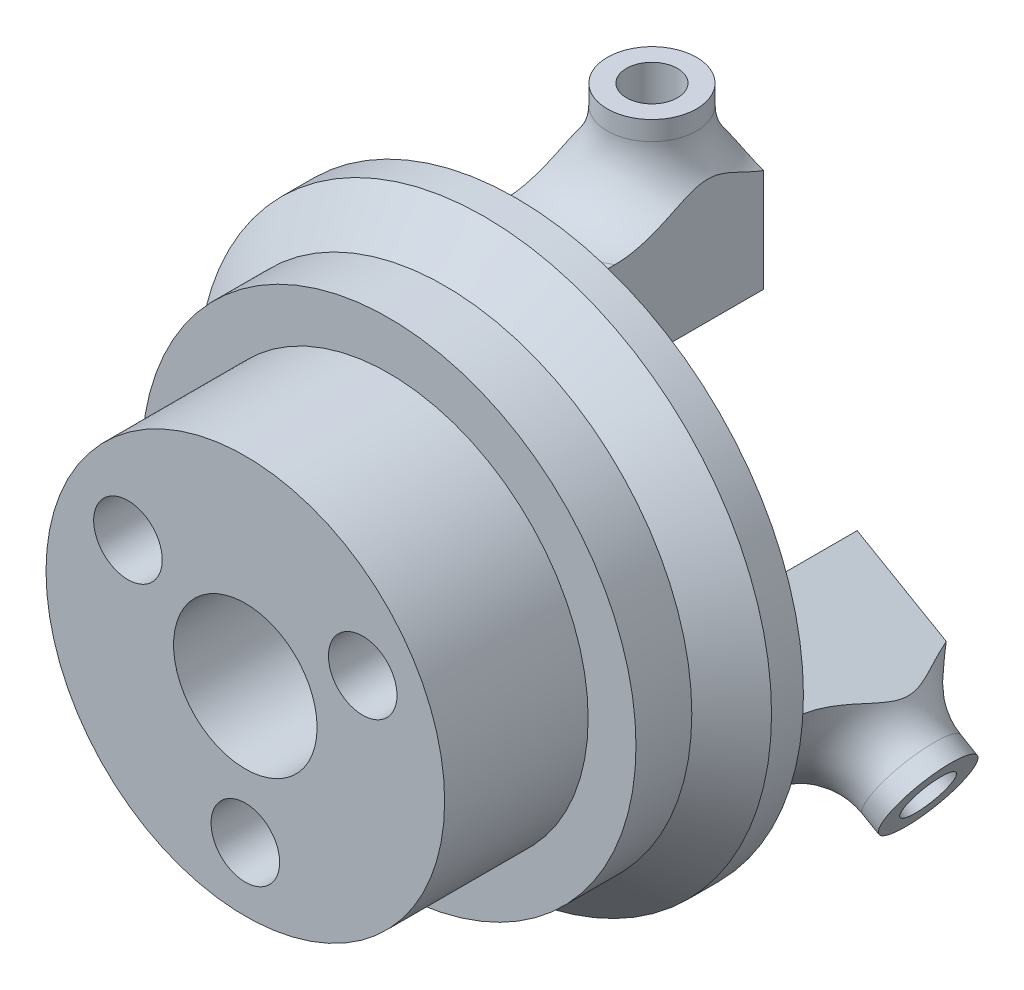
from build123d import *

# Parameters (mm, degrees)
SKETCH1_R                = 18
SKETCH1_R_2              = 4
BOSS_EXTRUDE1_DEPTH      = 2.5
SKETCH5_R                = 7.5
SKETCH5_R_2              = 4
BOSS_EXTRUDE3_DEPTH      = 1
SKETCH8_R                = 12.5
SKETCH8_R_2              = 4.5
BOSS_EXTRUDE5_DEPTH      = 12
SKETCH9_R                = 15.5
SKETCH9_R_2              = 12.5
BOSS_EXTRUDE6_DEPTH      = 3
M4_CLEARANCE_HOLE1_D     = 4.3
CUT_EXTRUDE2_DEPTH       = 2
CIRPATTERN2_COUNT        = 3
SKETCH15_W               = 7
SKETCH15_H               = 6
BOSS_EXTRUDE7_DEPTH      = 12
SKETCH16_R               = 2.8
BOSS_EXTRUDE8_DEPTH      = 5.2
SKETCH17_R               = 1.6
CUT_EXTRUDE3_DEPTH       = 9
CHAMFER1_SIZE            = 3
CUT_EXTRUDE5_DEPTH       = 2.85
FILLET3_R                = 4
FILLET5_R                = 1
CIRPATTERN4_COUNT        = 3
FILLET3_OF_CIRPATTERN4_R = 4
FILLET5_OF_CIRPATTERN4_R = 1


with BuildPart() as part:
    # Sketch1 → Boss-Extrude1 (new, symmetric)
    with BuildSketch(Plane.XY):
        Circle(SKETCH1_R)
        Circle(SKETCH1_R_2, mode=Mode.SUBTRACT)
    extrude(amount=BOSS_EXTRUDE1_DEPTH, both=True)

    # Sketch5 → Boss-Extrude3 (add)
    with BuildSketch(Plane.XY.offset(-2.5)):
        Circle(SKETCH5_R)
        Circle(SKETCH5_R_2, mode=Mode.SUBTRACT)
    extrude(amount=BOSS_EXTRUDE3_DEPTH)

    # Sketch8 → Boss-Extrude5 (add)
    with BuildSketch(Plane.XY.offset(2.5)):
        Circle(SKETCH8_R)
        Circle(SKETCH8_R_2, mode=Mode.SUBTRACT)
    extrude(amount=BOSS_EXTRUDE5_DEPTH)

    # Sketch9 → Boss-Extrude6 (add)
    with BuildSketch(Plane.XY.offset(2.5)):
        Circle(SKETCH9_R)
        Circle(SKETCH9_R_2, mode=Mode.SUBTRACT)
    extrude(amount=BOSS_EXTRUDE6_DEPTH)

    # M4 Clearance Hole1 (through all)
    with Locations(Plane.XY.offset(14.5)):
        with Locations((7.361215932, 4.25), (-7.361215932, 4.25), (0, -8.5)):
            Hole(M4_CLEARANCE_HOLE1_D / 2)

    # Sketch14 → Cut-Extrude2 (cut)
    with BuildSketch(Plane(origin=(0, 0, -2.5), x_dir=(-1, 0, 0), z_dir=(0, 0, -1))):
        Polygon((-11.691342951, 4.25), (-9.526279442, 8), (-5.196152423, 8), (-3.031088913, 4.25), (-5.196152423, 0.5), (-9.526279442, 0.5), align=None)
    cut_extrude2 = extrude(amount=-CUT_EXTRUDE2_DEPTH, mode=Mode.SUBTRACT)

    # CirPattern2: Cut-Extrude2 ×3 about axis
    cirpattern2_axis = Axis((0, 0, 0), (0, 0, 1))
    for i in range(1, CIRPATTERN2_COUNT):
        add(cut_extrude2.rotate(cirpattern2_axis, i * 360 / CIRPATTERN2_COUNT), mode=Mode.SUBTRACT)

    # Sketch15 → Boss-Extrude7 (add)
    with BuildSketch(Plane(origin=(0, 0, -2.5), x_dir=(-1, 0, 0), z_dir=(0, 0, -1))):
        with Locations((0, 11.8)):
            Rectangle(SKETCH15_W, SKETCH15_H)
    boss_extrude7 = extrude(amount=BOSS_EXTRUDE7_DEPTH)

    # Sketch16 → Boss-Extrude8 (add)
    with BuildSketch(Plane(origin=(0, 14.8, 0), x_dir=(1, 0, 0), z_dir=(0, 1, 0))):
        with Locations(Location((0, 11, 0), (0, 0, 90))):
            Circle(SKETCH16_R)
    boss_extrude8 = extrude(amount=BOSS_EXTRUDE8_DEPTH)

    # Sketch17 → Cut-Extrude3 (cut)
    with BuildSketch(Plane(origin=(0, 20, 0), x_dir=(1, 0, 0), z_dir=(0, 1, 0))):
        with Locations(Location((0, 11, 0), (0, 0, 270))):
            Circle(SKETCH17_R)
    cut_extrude3 = extrude(amount=-CUT_EXTRUDE3_DEPTH, mode=Mode.SUBTRACT)

    # Chamfer1
    # the kernel refuses this chamfer: 3 mm, written as the material it takes off along each edge
    with BuildSketch(Plane(origin=(0, 0, 2.5), x_dir=(1, 0, 0), z_dir=(0, -1, 0))) as chamfer1_piece_1_section:
        Polygon((18, -CHAMFER1_SIZE), (18 - CHAMFER1_SIZE, 0), (18, 0), align=None)
    chamfer1_piece_1 = revolve(axis=Axis((0, 0, 2.5), (0, 0, 1)), mode=Mode.PRIVATE)
    chamfer1_piece_1 = chamfer1_piece_1 - Plane(origin=(0, 0, 0.764094919), x_dir=(1, 0, 0), z_dir=(0, 0, -1)) * Cylinder(15.5, 72, mode=Mode.PRIVATE)
    add(chamfer1_piece_1, mode=Mode.SUBTRACT)

    # Sketch18 → Cut-Extrude5 (cut)
    with BuildSketch(Plane.XZ.offset(-8.8)):
        Polygon((-2.85, -9.354551733), (0, -7.709103466), (2.85, -9.354551733), (2.85, -12.645448267), (0, -14.290896534), (-2.85, -12.645448267), align=None)
    cut_extrude5 = extrude(amount=-CUT_EXTRUDE5_DEPTH, mode=Mode.SUBTRACT)

    # Fillet3
    # the kernel refuses this fillet: 4 mm, written as the material it adds along each edge
    with BuildSketch(Plane(origin=(0, 14.8, -11), x_dir=(0, 0, -1), z_dir=(1, 0, 0))) as fillet3_piece_1_section:
        with BuildLine():
            CenterArc((2.8 + FILLET3_R, FILLET3_R), FILLET3_R, 180, 90)
            Line((2.8, FILLET3_R), (2.8, 0))
            Line((2.8, 0), (2.8 + FILLET3_R, 0))
        make_face()
    fillet3_piece_1 = revolve(axis=Axis((0, 14.8, -11), (0, 1, 0)), mode=Mode.PRIVATE)
    fillet3_piece_1 = split(fillet3_piece_1, bisect_by=Plane(origin=(3.5, 15.943283653, -7.056716347), z_dir=(-1, 0, 0)), keep=Keep.TOP, mode=Mode.PRIVATE)
    fillet3_piece_1 = split(fillet3_piece_1, bisect_by=Plane(origin=(-3.5, 15.943283653, -7.056716347), z_dir=(1, 0, 0)), keep=Keep.TOP, mode=Mode.PRIVATE)
    fillet3_piece_1 = split(fillet3_piece_1, bisect_by=Plane(origin=(0, 15.943283653, -14.5), z_dir=(0, 0, 1)), keep=Keep.TOP, mode=Mode.PRIVATE)
    add(fillet3_piece_1)

    # Fillet5
    fillet5_edges = [part.edges().sort_by_distance(p)[0] for p in [
        (-3.5, 11.8, -2.5),
        (3.5, 11.8, -2.5),
        (0, 8.8, -2.5),
    ]]
    fillet(fillet5_edges, radius=FILLET5_R)

    # CirPattern4: Boss-Extrude7, Boss-Extrude8, Cut-Extrude3, Cut-Extrude5 ×3 about axis
    cirpattern4_axis = Axis((0, 0, 0), (0, 0, 1))
    add([boss_extrude7.rotate(cirpattern4_axis, i * 360 / CIRPATTERN4_COUNT) for i in range(1, CIRPATTERN4_COUNT)])
    add([boss_extrude8.rotate(cirpattern4_axis, i * 360 / CIRPATTERN4_COUNT) for i in range(1, CIRPATTERN4_COUNT)])
    add([cut_extrude3.rotate(cirpattern4_axis, i * 360 / CIRPATTERN4_COUNT) for i in range(1, CIRPATTERN4_COUNT)], mode=Mode.SUBTRACT)
    add([cut_extrude5.rotate(cirpattern4_axis, i * 360 / CIRPATTERN4_COUNT) for i in range(1, CIRPATTERN4_COUNT)], mode=Mode.SUBTRACT)

    # Fillet3 of CirPattern4
    # the kernel refuses this fillet: 4 mm, written as the material it adds along each edge
    with BuildSketch(Plane(origin=(-12.817175976, -7.4, -11), x_dir=(0, 0, -1), z_dir=(-0.49999999999999983, 0.8660254037844388, 0))) as fillet3_of_cirpattern4_piece_1_section:
        with BuildLine():
            CenterArc((2.8 + FILLET3_OF_CIRPATTERN4_R, FILLET3_OF_CIRPATTERN4_R), FILLET3_OF_CIRPATTERN4_R, 180, 90)
            Line((2.8, FILLET3_OF_CIRPATTERN4_R), (2.8, 0))
            Line((2.8, 0), (2.8 + FILLET3_OF_CIRPATTERN4_R, 0))
        make_face()
    fillet3_of_cirpattern4_piece_1 = revolve(axis=Axis((-12.817175976, -7.4, -11), (-0.8660254037844388, -0.49999999999999983, 0)), mode=Mode.PRIVATE)
    fillet3_of_cirpattern4_piece_1 = split(fillet3_of_cirpattern4_piece_1, bisect_by=Plane(origin=(-15.557288663, -4.940552913, -7.056716347), z_dir=(0.49999999999999983, -0.8660254037844388, 0)), keep=Keep.TOP, mode=Mode.PRIVATE)
    fillet3_of_cirpattern4_piece_1 = split(fillet3_of_cirpattern4_piece_1, bisect_by=Plane(origin=(-12.057288663, -11.00273074, -7.056716347), z_dir=(-0.49999999999999983, 0.8660254037844388, 0)), keep=Keep.TOP, mode=Mode.PRIVATE)
    fillet3_of_cirpattern4_piece_1 = split(fillet3_of_cirpattern4_piece_1, bisect_by=Plane(origin=(-13.807288663, -7.971641826, -14.5), z_dir=(0, 0, 1)), keep=Keep.TOP, mode=Mode.PRIVATE)
    add(fillet3_of_cirpattern4_piece_1)
    with BuildSketch(Plane(origin=(12.817175976, -7.4, -11), x_dir=(0, 0, -1), z_dir=(-0.5000000000000004, -0.8660254037844384, 0))) as fillet3_of_cirpattern4_piece_2_section:
        with BuildLine():
            CenterArc((2.8 + FILLET3_OF_CIRPATTERN4_R, FILLET3_OF_CIRPATTERN4_R), FILLET3_OF_CIRPATTERN4_R, 180, 90)
            Line((2.8, FILLET3_OF_CIRPATTERN4_R), (2.8, 0))
            Line((2.8, 0), (2.8 + FILLET3_OF_CIRPATTERN4_R, 0))
        make_face()
    fillet3_of_cirpattern4_piece_2 = revolve(axis=Axis((12.817175976, -7.4, -11), (0.8660254037844384, -0.5000000000000004, 0)), mode=Mode.PRIVATE)
    fillet3_of_cirpattern4_piece_2 = split(fillet3_of_cirpattern4_piece_2, bisect_by=Plane(origin=(12.057288663, -11.00273074, -7.056716347), z_dir=(0.5000000000000004, 0.8660254037844384, 0)), keep=Keep.TOP, mode=Mode.PRIVATE)
    fillet3_of_cirpattern4_piece_2 = split(fillet3_of_cirpattern4_piece_2, bisect_by=Plane(origin=(15.557288663, -4.940552913, -7.056716347), z_dir=(-0.5000000000000004, -0.8660254037844384, 0)), keep=Keep.TOP, mode=Mode.PRIVATE)
    fillet3_of_cirpattern4_piece_2 = split(fillet3_of_cirpattern4_piece_2, bisect_by=Plane(origin=(13.807288663, -7.971641826, -14.5), z_dir=(0, 0, 1)), keep=Keep.TOP, mode=Mode.PRIVATE)
    add(fillet3_of_cirpattern4_piece_2)

    # Fillet5 of CirPattern4
    fillet5_of_cirpattern4_edges = [part.edges().sort_by_distance(p)[0] for p in [
        (-8.469099765, -8.931088913, -2.5),
        (-11.969099765, -2.868911087, -2.5),
        (-7.621023553, -4.4, -2.5),
        (11.969099765, -2.868911087, -2.5),
        (8.469099765, -8.931088913, -2.5),
        (7.621023553, -4.4, -2.5),
    ]]
    fillet(fillet5_of_cirpattern4_edges, radius=FILLET5_OF_CIRPATTERN4_R)


solid = part.part
